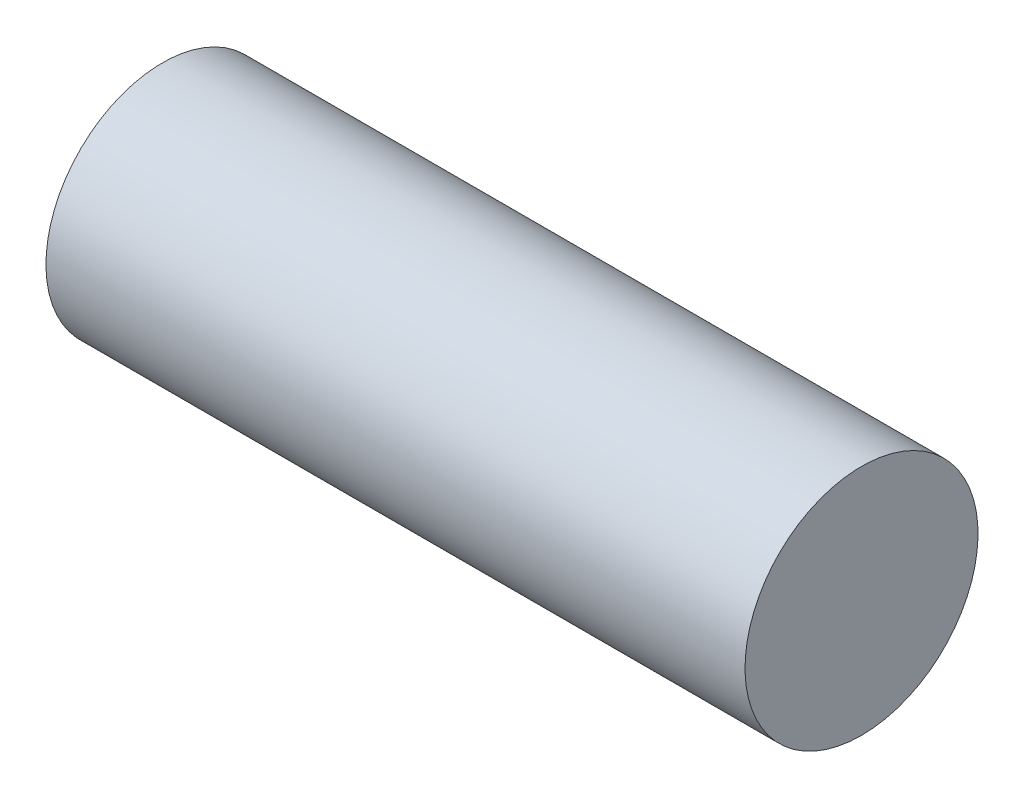
from build123d import *

# Parameters (mm, degrees)
BODYSKE_W = 30
BODYSKE_H = 5


with BuildPart() as part:
    # BodySke → Body (revolve)
    with BuildSketch(Plane.XY):
        with Locations((15, 2.5)):
            Rectangle(BODYSKE_W, BODYSKE_H)
    revolve(axis=Axis((0, 0, 0), (1, 0, 0)))


solid = part.part
